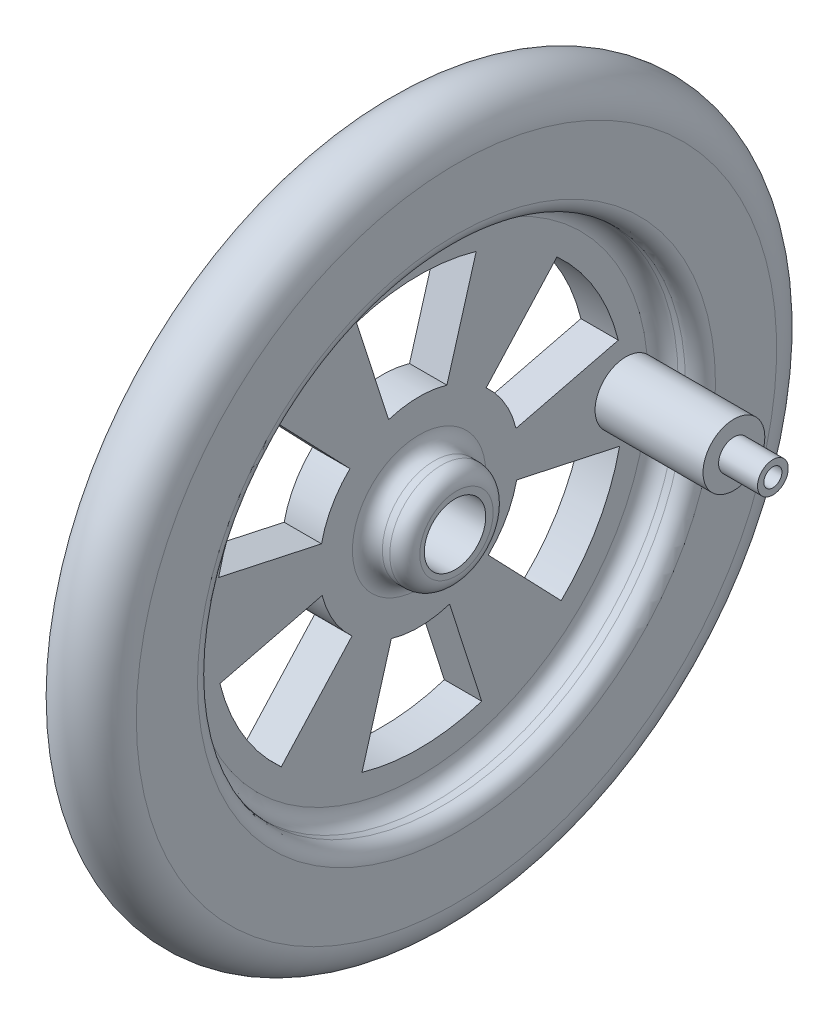
from build123d import *

# Parameters (mm, degrees)
CUT_EXTRUDE2_DEPTH  = 10.922
CIRPATTERN1_COUNT   = 6
SKETCH3_R           = 2.602345469
CUT_EXTRUDE3_DEPTH  = 10.922
FILLET2_R           = 1.27
SKETCH4_R           = 2.618812166
BOSS_EXTRUDE1_DEPTH = 9.144
SKETCH5_R           = 1.301172735
BOSS_EXTRUDE2_DEPTH = 3.302
SKETCH6_R           = 0.7664453
CUT_EXTRUDE4_DEPTH  = 3.302


# Read off the part's stored shape, not the designer's step: Revolve4
with BuildPart() as part:
    # Revolve4 outline → Revolve4 (revolve)
    with BuildSketch(Plane.YX.offset(27.122360615)):
        with BuildLine():
            Line((27.122360615, 6.331807), (20.671085558, 6.331807))
            Line((20.671085558, 6.331807), (20.671085558, 3.1659035))
            Line((20.671085558, 3.1659035), (4.380434598, 3.1659035))
            Line((4.380434598, 3.1659035), (4.380434598, 6.331807))
            Line((4.380434598, 6.331807), (0, 6.331807))
            Line((0, 6.331807), (0, 0))
            Line((0, 0), (27.122360615, 0))
            ThreePointArc((27.122360615, 0), (30.288264114, 3.1659035), (27.122360615, 6.331807))
        make_face()
    revolve(axis=Axis((0, 0, -27.122360615), (1, 0, 0)))

    # Sketch2 → Cut-Extrude2 (cut)
    with BuildSketch(Plane(origin=(3.1659035, 0, 0), x_dir=(0, 0, -1), z_dir=(1, 0, 0))):
        with BuildLine():
            Line((24.410396138, 8.457622774), (24.539910327, 8.053715509))
            ThreePointArc((24.539910327, 8.053715509), (27.003042461, 8.456781076), (29.476565703, 8.123367614))
            Line((29.476565703, 8.123367614), (29.573435035, 8.457622774))
            Line((29.573435035, 8.457622774), (31.959705051, 16.691632912))
            ThreePointArc((31.959705051, 16.691632912), (26.877189534, 17.376720105), (21.816025328, 16.548514021))
            Line((21.816025328, 16.548514021), (24.410396138, 8.457622774))
        make_face()
    cut_extrude2 = extrude(amount=-CUT_EXTRUDE2_DEPTH, mode=Mode.SUBTRACT)

    # CirPattern1: Cut-Extrude2 ×6 about axis
    cirpattern1_axis = Axis((6.331807, 0, -27.122360615), (-1, 0, 0))
    for i in range(1, CIRPATTERN1_COUNT):
        add(cut_extrude2.rotate(cirpattern1_axis, i * 360 / CIRPATTERN1_COUNT), mode=Mode.SUBTRACT)

    # Sketch3 → Cut-Extrude3 (cut)
    with BuildSketch(Plane(origin=(6.331807, 0, 0), x_dir=(0, 0, -1), z_dir=(1, 0, 0))):
        with Locations((27.000375671, 0)):
            Circle(SKETCH3_R)
    extrude(amount=-CUT_EXTRUDE3_DEPTH, mode=Mode.SUBTRACT)

    # Fillet2
    fillet2_edges = [part.edges().sort_by_distance(p)[0] for p in [
        (6.331807, -4.380434598, -27.122360615),
        (3.1659035, -4.380434598, -27.122360615),
        (3.1659035, -20.671085558, -27.122360615),
        (6.331807, -20.671085558, -27.122360615),
    ]]
    fillet(fillet2_edges, radius=FILLET2_R)

    # Sketch4 → Boss-Extrude1 (add)
    with BuildSketch(Plane(origin=(3.1659035, 0, 0), x_dir=(0, 0, -1), z_dir=(1, 0, 0))):
        with Locations((44.647530883, 0)):
            Circle(SKETCH4_R)
    extrude(amount=BOSS_EXTRUDE1_DEPTH)

    # Sketch5 → Boss-Extrude2 (add)
    with BuildSketch(Plane(origin=(12.3099035, 0, 0), x_dir=(0, 0, -1), z_dir=(1, 0, 0))):
        with Locations((44.647530883, 0)):
            Circle(SKETCH5_R)
    extrude(amount=BOSS_EXTRUDE2_DEPTH)

    # Sketch6 → Cut-Extrude4 (cut)
    with BuildSketch(Plane(origin=(15.6119035, 0, 0), x_dir=(0, 0, -1), z_dir=(1, 0, 0))):
        with Locations((44.647530883, 0)):
            Circle(SKETCH6_R)
    extrude(amount=-CUT_EXTRUDE4_DEPTH, mode=Mode.SUBTRACT)


solid = part.part
